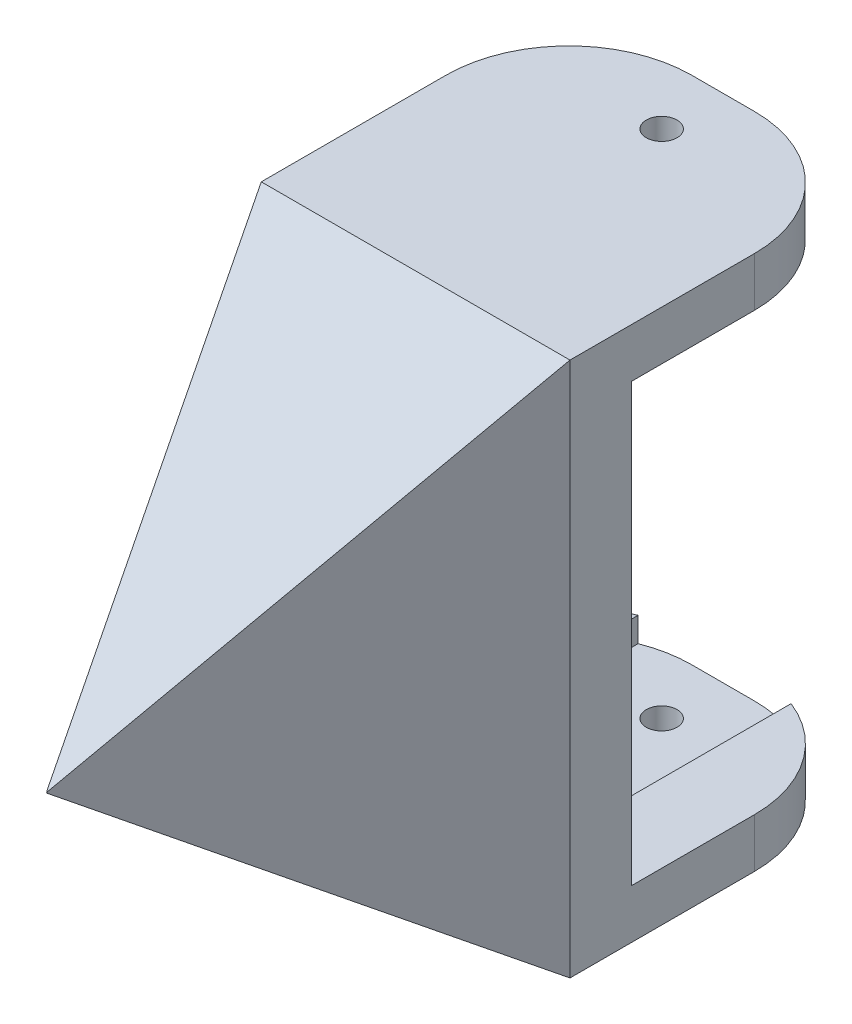
from build123d import *
from OCP.BRepFilletAPI import BRepFilletAPI_MakeChamfer

# Parameters (mm, degrees)
SKETCH4_W                = 12.46
SKETCH4_H                = 17.25
BOSS_EXTRUDE3_DEPTH      = 6
BOSS_EXTRUDE6_DEPTH      = 7.3
BOSS_EXTRUDE6_DEPTH_BACK = 17.25
SKETCH8_R                = 12.546781182
SKETCH8_R_2              = 11.15
BOSS_EXTRUDE4_DEPTH      = 17.25
SKETCH6_R                = 2
CUT_EXTRUDE1_DEPTH       = 5
CHAMFER1_SIZE            = 0.5
CHAMFER1_SIZE_2          = 0.866025404
SKETCH10_W               = 12.46
SKETCH10_H               = 23.7
CUT_EXTRUDE3_DEPTH       = 17.25
CUT_EXTRUDE4_REACH       = 43.938
SKETCH11_W               = 5
SKETCH11_H               = 3
BOSS_EXTRUDE7_START      = -7.3
BOSS_EXTRUDE7_DEPTH      = 7.3
BOSS_EXTRUDE9_START      = 10
BOSS_EXTRUDE9_DEPTH      = 10
BOSS_EXTRUDE10_DEPTH     = 25.093562364
SKETCH18_W               = 20
SKETCH18_H               = 12.438292938
CUT_EXTRUDE5_DEPTH       = 2
CUT_EXTRUDE6_DEPTH       = 57.41497434
CUT_EXTRUDE6_DEPTH_BACK  = 57.41497434
SKETCH19_R               = 1.25
FILLET1_R                = 10
CUT_EXTRUDE7_DEPTH       = 55.620050849
CUT_EXTRUDE7_DEPTH_BACK  = 55.620050849
SKETCH20_W               = 25.093562364
SKETCH20_H               = 36.096781182
BOSS_EXTRUDE11_DEPTH     = 43.5
CUT_EXTRUDE8_DEPTH       = 40.12140358
CUT_EXTRUDE8_DEPTH_BACK  = 40.12140358
CUT_EXTRUDE9_DEPTH       = 40.12140358
CUT_EXTRUDE9_DEPTH_BACK  = 40.12140358


with BuildPart() as part:
    # Sketch4 → Boss-Extrude3 (new body)
    with BuildSketch(Plane.XY):
        with Locations((0, -1.35)):
            Rectangle(SKETCH4_W, SKETCH4_H)
    extrude(amount=BOSS_EXTRUDE3_DEPTH)



with BuildPart() as body_2:
    # Sketch8 → Boss-Extrude6 (new, two sides: drawn at the far end of the back side and taken through both)
    with BuildSketch(Plane(origin=(0, -9.975, 0), x_dir=(-1, 0, 0), z_dir=(0, -1, 0)).offset(-BOSS_EXTRUDE6_DEPTH_BACK)):
        with Locations(Location((0, -23.55, 0), (0, 0, 90))):
            Circle(SKETCH8_R)
        with Locations(Location((0, -23.55, 0), (0, 0, 90))):
            Circle(SKETCH8_R_2, mode=Mode.SUBTRACT)
    extrude(amount=BOSS_EXTRUDE6_DEPTH + BOSS_EXTRUDE6_DEPTH_BACK)


with BuildPart() as part_1:
    add(part.part)

    add(body_2.part)  # Boss-Extrude4 merges body 2
    # Sketch5 → Boss-Extrude4 (add)
    with BuildSketch(Plane(origin=(0, 7.275, 0), x_dir=(1, 0, 0), z_dir=(0, 1, 0))):
        with BuildLine():
            Line((12.546781182, -23.55), (12.546781182, 0))
            Line((12.546781182, 0), (6.23, 0))
            Line((6.23, 0), (6.23, -29.7))
            Line((6.23, -29.7), (-6.23, -29.7))
            Line((-6.23, -29.7), (-6.23, 0))
            Line((-6.23, 0), (-12.546781182, 0))
            Line((-12.546781182, 0), (-12.546781182, -23.55))
            ThreePointArc((-12.546781182, -23.55), (0, -36.096781182), (12.546781182, -23.55))
        make_face()
    extrude(amount=-BOSS_EXTRUDE4_DEPTH)

    # Sketch6 → Cut-Extrude1 (cut)
    with BuildSketch(Plane(origin=(0, 7.275, 0), x_dir=(1, 0, 0), z_dir=(0, 1, 0))):
        with Locations(Location((0, -3.5, 0), (0, 0, 270))):
            Circle(SKETCH6_R)
        with Locations(Location((0, -32.2, 0), (0, 0, 270))):
            Circle(SKETCH6_R)
    extrude(amount=-CUT_EXTRUDE1_DEPTH, mode=Mode.SUBTRACT)

    # Chamfer1
    chamfer1_edges_1 = [part_1.edges().sort_by_distance(p)[0] for p in [
        (0, 7.275, 1.5),
    ]]
    chamfer1_side_1 = [part_1.faces().sort_by_distance(p)[0] for p in [
        (0, 7.275, 1.49),
    ]]
    chamfer1_edges_2 = [part_1.edges().sort_by_distance(p)[0] for p in [
        (0, 7.275, 30.2),
    ]]
    chamfer1_side_2 = [part_1.faces().sort_by_distance(p)[0] for p in [
        (0, 7.275, 30.19),
    ]]
    chamfer1 = BRepFilletAPI_MakeChamfer(part_1.part.solid().wrapped)
    for e in chamfer1_edges_1:
        chamfer1.Add(CHAMFER1_SIZE - 0.0001, CHAMFER1_SIZE_2 - 0.0001, e.wrapped, chamfer1_side_1[0].wrapped)
    for e in chamfer1_edges_2:
        chamfer1.Add(CHAMFER1_SIZE - 0.0001, CHAMFER1_SIZE_2 - 0.0001, e.wrapped, chamfer1_side_2[0].wrapped)
    add(Compound.cast(chamfer1.Shape()), mode=Mode.REPLACE)  # a hair under: the kernel refuses the full size

    # Sketch10 → Cut-Extrude3 (cut)
    with BuildSketch(Plane(origin=(0, 7.275, 0), x_dir=(1, 0, 0), z_dir=(0, 1, 0))):
        with Locations((0, -17.85)):
            Rectangle(SKETCH10_W, SKETCH10_H)
    extrude(amount=-CUT_EXTRUDE3_DEPTH, mode=Mode.SUBTRACT)

    # Sketch11 → Cut-Extrude4 (cut, up to next)
    with BuildSketch(Plane.XY.offset(36.096781182), mode=Mode.PRIVATE) as cut_extrude4_sk1:
        with Locations((0, -8.475)):
            Rectangle(SKETCH11_W, SKETCH11_H)
    cut_extrude4_tool1 = extrude(cut_extrude4_sk1.sketch, amount=-CUT_EXTRUDE4_REACH, mode=Mode.PRIVATE) & part_1.part
    add(cut_extrude4_tool1.solids().sort_by_distance((0, -8.475, 36.096781))[0], mode=Mode.SUBTRACT)

    # Sketch13 → Boss-Extrude7 (add)
    with BuildSketch(Plane.XZ.offset(17.275).offset(BOSS_EXTRUDE7_START)):
        with BuildLine():
            Line((-12.546781182, 23.55), (-12.546781182, 0))
            Line((-12.546781182, 0), (12.546781182, 0))
            Line((12.546781182, 0), (12.546781182, 23.55))
            ThreePointArc((12.546781182, 23.55), (0, 11.003218818), (-12.546781182, 23.55))
        make_face()
    extrude(amount=BOSS_EXTRUDE7_DEPTH)

    # Sketch15 → Boss-Extrude9 (add)
    with BuildSketch(Plane(origin=(0, 7.275, 0), x_dir=(1, 0, 0), z_dir=(0, 1, 0)).offset(BOSS_EXTRUDE9_START)):
        with BuildLine():
            Line((-12.546781182, 0), (12.546781182, 0))
            Line((12.546781182, 0), (12.546781182, -23.55))
            ThreePointArc((12.546781182, -23.55), (0, -36.096781182), (-12.546781182, -23.55))
            Line((-12.546781182, -23.55), (-12.546781182, 0))
        make_face()
        with BuildLine():
            Line((-6.23, -0.8), (6.23, -0.8))
            Line((6.23, -0.8), (6.23, -33.5))
            ThreePointArc((6.23, -33.5), (5.937106781, -34.207106781), (5.23, -34.5))
            Line((5.23, -34.5), (-5.23, -34.5))
            ThreePointArc((-5.23, -34.5), (-5.937106781, -34.207106781), (-6.23, -33.5))
            Line((-6.23, -33.5), (-6.23, -0.8))
        make_face(mode=Mode.SUBTRACT)
    extrude(amount=-BOSS_EXTRUDE9_DEPTH)

    # Sketch17 → Boss-Extrude10 (add)
    with BuildSketch(Plane(origin=(-12.546781182, 4.728218818, 0), x_dir=(0, -1, 0), z_dir=(1, 0, 0))):
        Polygon((26.478218818, 25), (26.478218818, 0), (-17.021781182, 0), (-17.021781182, 25), (-13.021781182, 25), (-13.021781182, 5), (22.478218818, 5), (22.478218818, 25), align=None)
    extrude(amount=BOSS_EXTRUDE10_DEPTH)

    # Sketch18 → Cut-Extrude5 (cut)
    with BuildSketch(Plane.ZX.offset(-17.75)):
        with Locations((-15, 0)):
            Rectangle(SKETCH18_W, SKETCH18_H)
    extrude(amount=-CUT_EXTRUDE5_DEPTH, mode=Mode.SUBTRACT)

    # Sketch19 → Cut-Extrude6 (cut, two sides: drawn at the far end of the back side and taken through both)
    with BuildSketch(Plane.ZX.offset(-19.75).offset(-CUT_EXTRUDE6_DEPTH_BACK)):
        with Locations((-20, 0)):
            Circle(SKETCH19_R)
    extrude(amount=CUT_EXTRUDE6_DEPTH + CUT_EXTRUDE6_DEPTH_BACK, mode=Mode.SUBTRACT)

    # Fillet1
    fillet1_edges = [part_1.edges().sort_by_distance(p)[0] for p in [
        (12.546781182, -19.75, -25),
        (-12.546781182, -19.75, -25),
        (-12.546781182, 19.75, -25),
        (12.546781182, 19.75, -25),
    ]]
    fillet(fillet1_edges, radius=FILLET1_R)

    # Sketch20 → Cut-Extrude7 (cut, two sides: drawn at the far end of the back side and taken through both)
    with BuildSketch(Plane(origin=(0, 17.275, 0), x_dir=(1, 0, 0), z_dir=(0, 1, 0)).offset(-CUT_EXTRUDE7_DEPTH_BACK)):
        with Locations((0, -18.048390591)):
            Rectangle(SKETCH20_W, SKETCH20_H)
    extrude(amount=CUT_EXTRUDE7_DEPTH + CUT_EXTRUDE7_DEPTH_BACK, mode=Mode.SUBTRACT)

    # Sketch21 → Boss-Extrude11 (add)
    with BuildSketch(Plane(origin=(0, 21.75, 0), x_dir=(1, 0, 0), z_dir=(0, 1, 0))):
        Polygon((12.546781182, 0), (-0.025415104, -30), (-12.546781182, 0), align=None)
    extrude(amount=-BOSS_EXTRUDE11_DEPTH)

    # Sketch22 → Cut-Extrude8 (cut, two sides: drawn at the far end of the back side and taken through both)
    with BuildSketch(Plane(origin=(0, 0, 0), x_dir=(0, 0, -1), z_dir=(1, 0, 0)).offset(-CUT_EXTRUDE8_DEPTH_BACK)):
        Polygon((0, 21.75), (-30, 0.01), (-30, 21.75), align=None)
        Polygon((0, -21.75), (-30, -21.75), (-30, -0.01), align=None)
    extrude(amount=CUT_EXTRUDE8_DEPTH + CUT_EXTRUDE8_DEPTH_BACK, mode=Mode.SUBTRACT)

    # Sketch23 → Cut-Extrude9 (cut, two sides: drawn at the far end of the back side and taken through both)
    with BuildSketch(Plane(origin=(0, 0, 0), x_dir=(-1, 0, 0), z_dir=(0, 0, -1)).offset(-CUT_EXTRUDE9_DEPTH_BACK)):
        Polygon((12.546781182, 17.75), (0, 0), (12.546781182, -21.75), align=None)
    extrude(amount=CUT_EXTRUDE9_DEPTH + CUT_EXTRUDE9_DEPTH_BACK, mode=Mode.SUBTRACT)


solid = part_1.part
